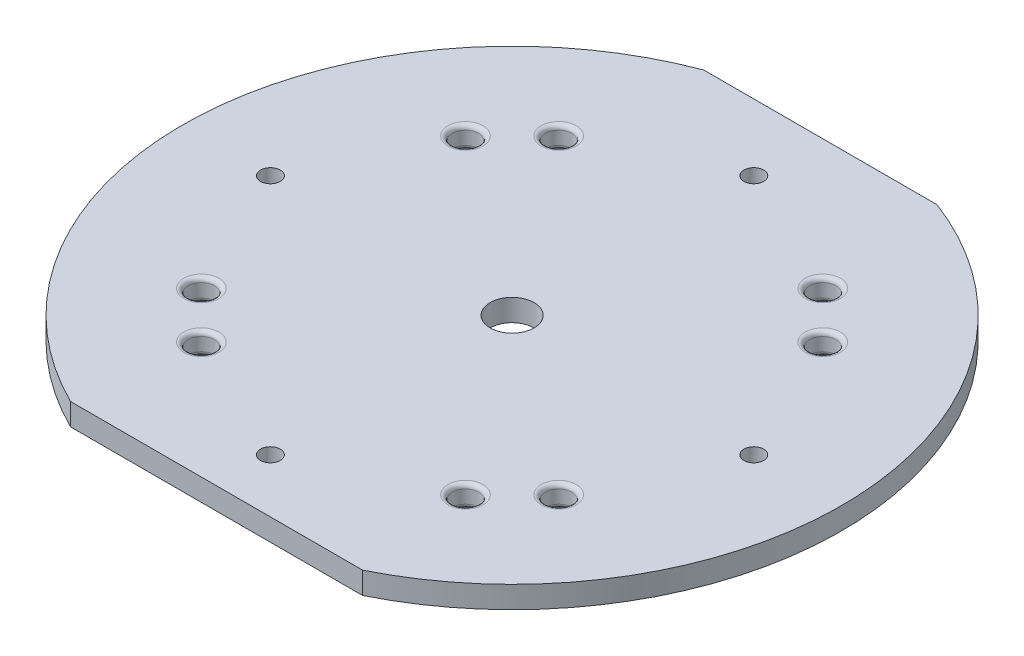
from build123d import *
from OCP.BRepFilletAPI import BRepFilletAPI_MakeChamfer

# Parameters (mm, degrees)
BOSS_EXTRUDE10_DEPTH             = 38
CUT_EXTRUDE7_DEPTH               = 114.357840488
CUT_EXTRUDE7_DEPTH_BACK          = 114.357840488
CUT_EXTRUDE8_REACH               = 164.861
SKETCH44_W                       = 5
SKETCH44_H                       = 3
BOSS_EXTRUDE11_DEPTH             = 13
CHAMFER11_SIZE                   = 3
CHAMFER11_SIZE_2                 = 13
F_2_0_START                      = 25.919230669
F_2_0_2_DIAMETER_HOLE1_OUTLINE_R = 1
F_2_0_2_DIAMETER_HOLE1_DEPTH     = 4.730769331
M4_CLEARANCE_HOLE1_D             = 4.5
F_6_0_6_DIAMETER_HOLE1_D         = 6
FILLET33_R                       = 1
F_3_0_3_DIAMETER_HOLE2_D         = 3
F_3_0_3_DIAMETER_HOLE2_DEPTH     = 2.238381896
SKETCH53_R                       = 75
CUT_EXTRUDE9_DEPTH               = 111.204355799


# Read off the part's stored shape, not the designer's step: Ø2.0 (2) Diameter Hole1
with BuildPart() as part:
    # Sketch34 → Revolve1 (revolve)
    with BuildSketch(Plane.XY, mode=Mode.PRIVATE) as revolve1_sk:
        Polygon((5, 0), (75, 0), (75, 45), (73, 43), (73, 5), (5, 5), align=None)
    revolve(revolve1_sk.sketch.rotate(Axis((0, 0, 0), (0, 1, 0)), 90), axis=Axis((0, 0, 0), (0, 1, 0)))

    # Sketch35 → Boss-Extrude10 (add)
    with BuildSketch(Plane(origin=(0, 5, 0), x_dir=(1, 0, 0), z_dir=(0, 1, 0))):
        with BuildLine():
            Line((-26.551836095, 68), (26.551836095, 68))
            ThreePointArc((26.551836095, 68), (0, 73), (-26.551836095, 68))
        make_face()
        with BuildLine():
            Line((33.226495452, -65), (-33.226495452, -65))
            ThreePointArc((-33.226495452, -65), (0, -73), (33.226495452, -65))
        make_face()
    extrude(amount=BOSS_EXTRUDE10_DEPTH)

    # Sketch36 → Cut-Extrude7 (cut, two sides: drawn at the far end of the back side and taken through both)
    with BuildSketch(Plane(origin=(0, 5, 0), x_dir=(1, 0, 0), z_dir=(0, 1, 0)).offset(-CUT_EXTRUDE7_DEPTH_BACK)):
        with BuildLine():
            Line((-26.551836095, 70.142711667), (26.551836095, 70.142711667))
            ThreePointArc((26.551836095, 70.142711667), (0, 75), (-26.551836095, 70.142711667))
        make_face()
        with BuildLine():
            Line((-33.226495452, -67.238381896), (33.226495452, -67.238381896))
            ThreePointArc((33.226495452, -67.238381896), (0, -75), (-33.226495452, -67.238381896))
        make_face()
    extrude(amount=CUT_EXTRUDE7_DEPTH + CUT_EXTRUDE7_DEPTH_BACK, mode=Mode.SUBTRACT)

    # Sketch43 → Cut-Extrude8 (cut, up to next)
    with BuildSketch(Plane.XY.offset(67.238381896), mode=Mode.PRIVATE) as cut_extrude8_sk1:
        with BuildLine():
            Line((-33.226495452, 29), (33.226495452, 29))
            Line((33.226495452, 29), (33.226495452, 36.795504442))
            ThreePointArc((33.226495452, 36.795504442), (33.791441286, 39.104247508), (35.35861327, 40.891264663))
            Line((35.35861327, 40.891264663), (39.935107214, 44.095760221))
            ThreePointArc((39.935107214, 44.095760221), (41.299460399, 44.768584754), (42.802989396, 45))
            Line((42.802989396, 45), (-42.802989396, 45))
            ThreePointArc((-42.802989396, 45), (-41.299460399, 44.768584754), (-39.935107214, 44.095760221))
            Line((-39.935107214, 44.095760221), (-35.35861327, 40.891264663))
            ThreePointArc((-35.35861327, 40.891264663), (-33.791441286, 39.104247508), (-33.226495452, 36.795504442))
            Line((-33.226495452, 36.795504442), (-33.226495452, 29))
        make_face()
    cut_extrude8_tool1 = extrude(cut_extrude8_sk1.sketch, amount=-CUT_EXTRUDE8_REACH, mode=Mode.PRIVATE) & part.part
    add(cut_extrude8_tool1.solids().sort_by_distance((0, 37.254898, 67.238382))[0], mode=Mode.SUBTRACT)

    # Sketch44 → Boss-Extrude11 (add)
    with BuildSketch(Plane.XY.offset(-68)):
        with Locations((-19.45, 29.15)):
            Rectangle(SKETCH44_W, SKETCH44_H)
        with Locations((8.55, 29.15)):
            Rectangle(SKETCH44_W, SKETCH44_H)
    extrude(amount=BOSS_EXTRUDE11_DEPTH)

    # Chamfer11
    chamfer11_edges_1 = [part.edges().sort_by_distance(p)[0] for p in [
        (8.55, 27.65, -68),
    ]]
    chamfer11_side_1 = [part.faces().sort_by_distance(p)[0] for p in [
        (8.55, 27.59, -68),
    ]]
    chamfer11_edges_2 = [part.edges().sort_by_distance(p)[0] for p in [
        (-19.45, 27.65, -68),
    ]]
    chamfer11_side_2 = [part.faces().sort_by_distance(p)[0] for p in [
        (-19.45, 27.59, -68),
    ]]
    chamfer11 = BRepFilletAPI_MakeChamfer(part.part.solid().wrapped)
    for e in chamfer11_edges_1:
        chamfer11.Add(CHAMFER11_SIZE - 0.0001, CHAMFER11_SIZE_2 - 0.0001, e.wrapped, chamfer11_side_1[0].wrapped)
    for e in chamfer11_edges_2:
        chamfer11.Add(CHAMFER11_SIZE - 0.0001, CHAMFER11_SIZE_2 - 0.0001, e.wrapped, chamfer11_side_2[0].wrapped)
    add(Compound.cast(chamfer11.Shape()), mode=Mode.REPLACE)  # a hair under: the kernel refuses the full size

    # Ø2.0 (2) Diameter Hole1 outline → Ø2.0 (2) Diameter Hole1 (cut)
    with BuildSketch(Plane(origin=(0, 0, 0), x_dir=(1, 0, 0), z_dir=(0, 1, 0)).offset(F_2_0_START)):
        with Locations((8.55, 61.5)):
            Circle(F_2_0_2_DIAMETER_HOLE1_OUTLINE_R)
        with Locations((-19.45, 61.5)):
            Circle(F_2_0_2_DIAMETER_HOLE1_OUTLINE_R)
    extrude(amount=F_2_0_2_DIAMETER_HOLE1_DEPTH, mode=Mode.SUBTRACT)

    # M4 Clearance Hole1 (through all)
    with Locations(Plane(origin=(0, 5, 0), x_dir=(1, 0, 0), z_dir=(0, 1, 0))):
        with Locations((-55, 0), (55, 0), (0, 55), (0, -55)):
            Hole(M4_CLEARANCE_HOLE1_D / 2)

    # Ø6.0 (6) Diameter Hole1 (through all)
    with Locations(Plane(origin=(0, 5, 0), x_dir=(1, 0, 0), z_dir=(0, 1, 0))):
        with Locations((30.0520382, 40.658639918), (40.658639918, 30.0520382), (40.658639918, -30.0520382), (30.0520382, -40.658639918), (-30.0520382, -40.658639918), (-40.658639918, -30.0520382), (-40.658639918, 30.0520382), (-30.0520382, 40.658639918)):
            Hole(F_6_0_6_DIAMETER_HOLE1_D / 2)

    # Fillet33
    fillet33_edges = [part.edges().sort_by_distance(p)[0] for p in [
        (-27.0520382, 5, -40.658639918),
        (-27.0520382, 0, -40.658639918),
        (-37.658639918, 5, -30.0520382),
        (-37.658639918, 0, -30.0520382),
        (-37.658639918, 5, 30.0520382),
        (-37.658639918, 0, 30.0520382),
        (-27.0520382, 5, 40.658639918),
        (-27.0520382, 0, 40.658639918),
        (33.0520382, 5, 40.658639918),
        (33.0520382, 0, 40.658639918),
        (43.658639918, 5, 30.0520382),
        (43.658639918, 0, 30.0520382),
        (43.658639918, 5, -30.0520382),
        (43.658639918, 0, -30.0520382),
        (33.0520382, 5, -40.658639918),
        (33.0520382, 0, -40.658639918),
    ]]
    fillet(fillet33_edges, radius=FILLET33_R)

    # Ø3.0 (3) Diameter Hole2
    with Locations(Plane.XY.offset(67.238381896)):
        with Locations((0, 22), (-15, 8), (15, 8)):
            Hole(F_3_0_3_DIAMETER_HOLE2_D / 2, depth=F_3_0_3_DIAMETER_HOLE2_DEPTH)

    # Sketch53 → Cut-Extrude9 (cut, through all)
    with BuildSketch(Plane(origin=(0, 5, 0), x_dir=(1, 0, 0), z_dir=(0, 1, 0))):
        Circle(SKETCH53_R)
    extrude(amount=CUT_EXTRUDE9_DEPTH, mode=Mode.SUBTRACT)


solid = part.part
